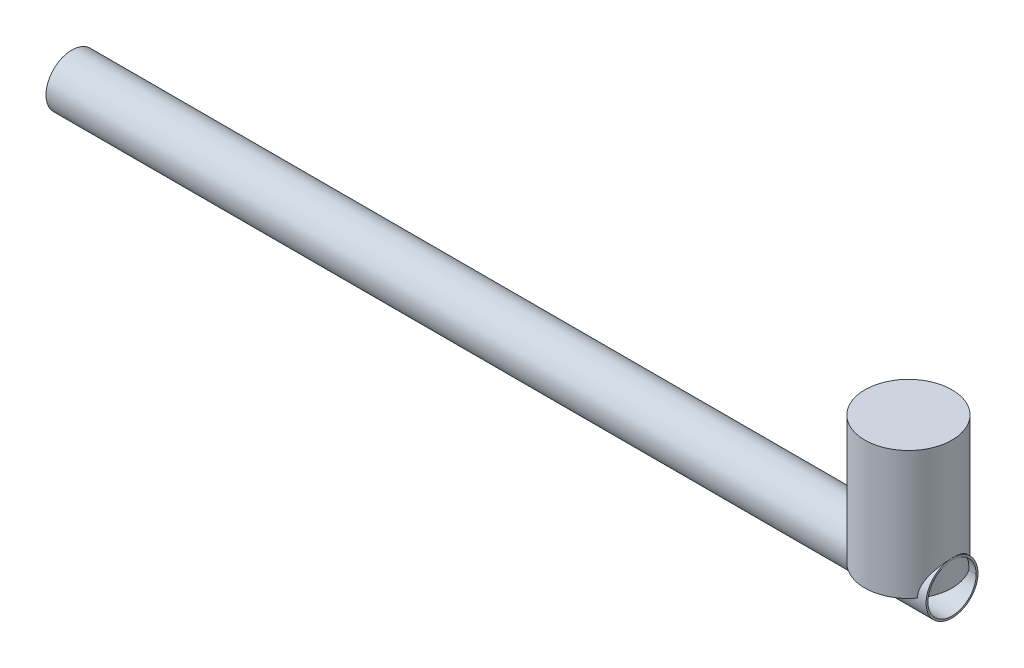
from build123d import *

# Parameters (mm, degrees)
SKETCH1_R           = 12.7
SKETCH1_R_2         = 11.811
BOSS_EXTRUDE1_DEPTH = 430.586
SKETCH2_R           = 21.33128873
BOSS_EXTRUDE2_DEPTH = 62.7


with BuildPart() as part:
    # Sketch1 → Boss-Extrude1 (new body)
    with BuildSketch(Plane(origin=(0, 0, 0), x_dir=(0, 0, -1), z_dir=(1, 0, 0))):
        Circle(SKETCH1_R)
        Circle(SKETCH1_R_2, mode=Mode.SUBTRACT)
    extrude(amount=BOSS_EXTRUDE1_DEPTH)

    # Sketch2 → Boss-Extrude2 (add)
    with BuildSketch(Plane(origin=(0, 0, 0), x_dir=(1, 0, 0), z_dir=(0, 1, 0))):
        with Locations((409.25471127, 0)):
            Circle(SKETCH2_R)
    extrude(amount=BOSS_EXTRUDE2_DEPTH)


solid = part.part
